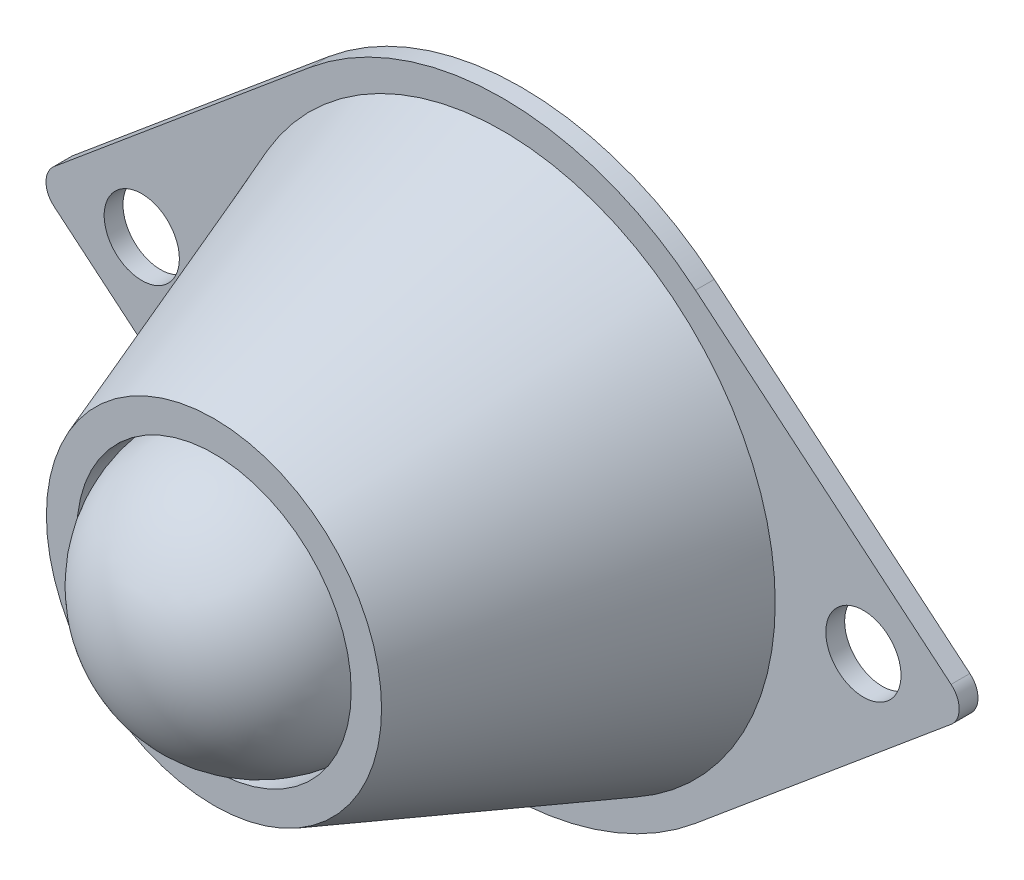
from build123d import *

# Parameters (mm, degrees)
SKETCH1_R           = 2
BOSS_EXTRUDE1_DEPTH = 1
SKETCH2_R           = 14.5
BOSS_EXTRUDE7_DEPTH = 15.35
BOSS_EXTRUDE7_TAPER = 20
SKETCH5_R           = 7.3
CUT_EXTRUDE1_DEPTH  = 2.4


with BuildPart() as part:
    # Sketch1 → Boss-Extrude1 (new body)
    with BuildSketch(Plane.XY):
        with BuildLine():
            Line((-23.852790838, 0.920895504), (-10.258451011, 12.278606715))
            ThreePointArc((-10.258451011, 12.278606715), (0, 16), (10.258451011, 12.278606715))
            Line((10.258451011, 12.278606715), (23.852790838, 0.920895504))
            ThreePointArc((23.852790838, 0.920895504), (24.283407012, 0), (23.852790838, -0.920895504))
            Line((23.852790838, -0.920895504), (10.258451011, -12.278606715))
            ThreePointArc((10.258451011, -12.278606715), (0, -16), (-10.258451011, -12.278606715))
            Line((-10.258451011, -12.278606715), (-23.852790838, -0.920895504))
            ThreePointArc((-23.852790838, -0.920895504), (-24.283407012, 0), (-23.852790838, 0.920895504))
        make_face()
        with Locations((-19.19, 0)):
            Circle(SKETCH1_R, mode=Mode.SUBTRACT)
        with Locations((19.19, 0)):
            Circle(SKETCH1_R, mode=Mode.SUBTRACT)
    extrude(amount=BOSS_EXTRUDE1_DEPTH)

    # Sketch2 → Boss-Extrude7 (add)
    with BuildSketch(Plane.XY.offset(1)):
        Circle(SKETCH2_R)
    extrude(amount=BOSS_EXTRUDE7_DEPTH, taper=BOSS_EXTRUDE7_TAPER)

    # Sketch5 → Cut-Extrude1 (cut)
    with BuildSketch(Plane.XY.offset(16.35)):
        Circle(SKETCH5_R)
    extrude(amount=-CUT_EXTRUDE1_DEPTH, mode=Mode.SUBTRACT)

    # Sketch6 → Revolve3 (revolve)
    with BuildSketch(Plane.XY.offset(13.95)):
        with BuildLine():
            Line((0, -7.3), (0, 7.3))
            ThreePointArc((0, 7.3), (-7.3, 0), (0, -7.3))
        make_face()
    revolve(axis=Axis((0, -7.3, 13.95), (0, 1, 0)))


solid = part.part
